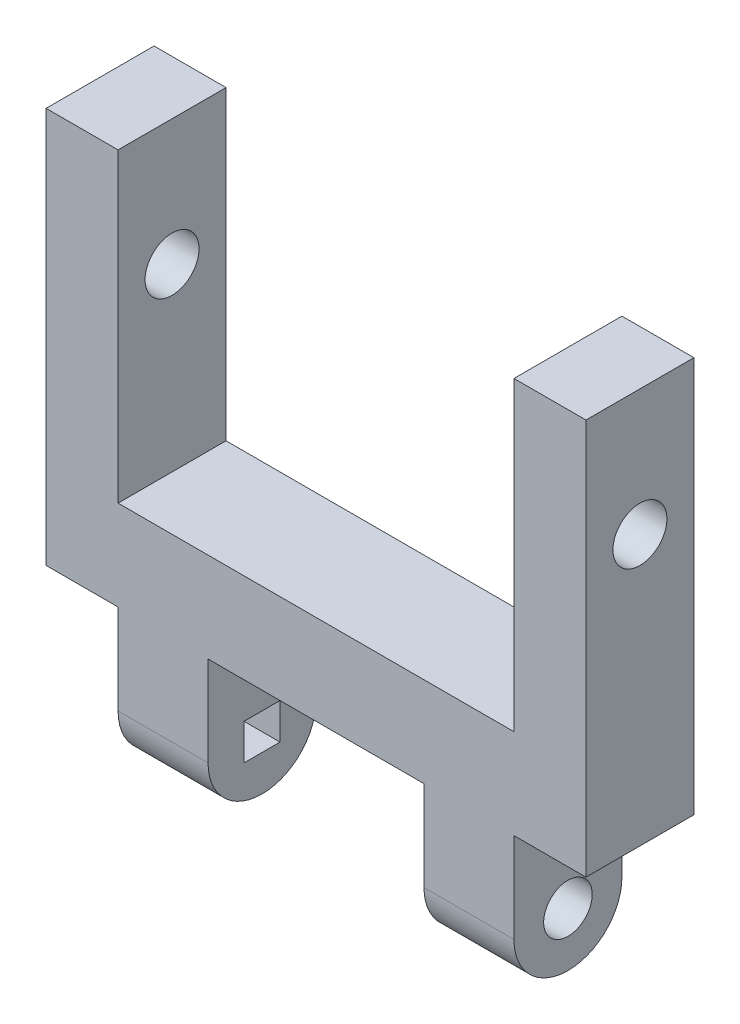
from build123d import *

# Parameters (mm, degrees)
SKETCH3_W           = 30
SKETCH3_H           = 6
BOSS_EXTRUDE2_DEPTH = 5
SKETCH4_W           = 4
SKETCH4_H           = 6
BOSS_EXTRUDE3_DEPTH = 17
SKETCH7_R           = 1.5
CUT_EXTRUDE2_DEPTH  = 50
SKETCH9_W           = 5
SKETCH9_H           = 6
BOSS_EXTRUDE5_DEPTH = 8
SKETCH10_R          = 1.35
CUT_EXTRUDE3_DEPTH  = 8
SKETCH11_W          = 2
SKETCH11_H          = 2
CUT_EXTRUDE4_DEPTH  = 8
FILLET2_R           = 3


with BuildPart() as part:
    # Sketch3 → Boss-Extrude2 (new body)
    with BuildSketch(Plane(origin=(0, 0, 0), x_dir=(1, 0, 0), z_dir=(0, 1, 0))):
        Rectangle(SKETCH3_W, SKETCH3_H)
    extrude(amount=BOSS_EXTRUDE2_DEPTH)

    # Sketch4 → Boss-Extrude3 (add)
    with BuildSketch(Plane(origin=(0, 5, 0), x_dir=(1, 0, 0), z_dir=(0, 1, 0))):
        with Locations((-13, 0)):
            Rectangle(SKETCH4_W, SKETCH4_H)
        with Locations((13, 0)):
            Rectangle(SKETCH4_W, SKETCH4_H)
    extrude(amount=BOSS_EXTRUDE3_DEPTH)

    # Sketch7 → Cut-Extrude2 (cut, symmetric)
    with BuildSketch(Plane.ZY.offset(-11)):
        with Locations((0, 15)):
            Circle(SKETCH7_R)
    extrude(amount=CUT_EXTRUDE2_DEPTH, both=True, mode=Mode.SUBTRACT)

    # Sketch9 → Boss-Extrude5 (add)
    with BuildSketch(Plane.XZ):
        with Locations((-8.5, 0)):
            Rectangle(SKETCH9_W, SKETCH9_H)
        with Locations((8.5, 0)):
            Rectangle(SKETCH9_W, SKETCH9_H)
    extrude(amount=BOSS_EXTRUDE5_DEPTH)

    # Sketch10 → Cut-Extrude3 (cut)
    with BuildSketch(Plane(origin=(11, 0, 0), x_dir=(0, 0, -1), z_dir=(1, 0, 0))):
        with Locations((0, -5)):
            Circle(SKETCH10_R)
    extrude(amount=-CUT_EXTRUDE3_DEPTH, mode=Mode.SUBTRACT)

    # Sketch11 → Cut-Extrude4 (cut)
    with BuildSketch(Plane.ZY.offset(11)):
        with Locations((0, -5)):
            Rectangle(SKETCH11_W, SKETCH11_H)
    extrude(amount=-CUT_EXTRUDE4_DEPTH, mode=Mode.SUBTRACT)

    # Fillet2
    fillet2_edges = [part.edges().sort_by_distance(p)[0] for p in [
        (-8.5, -8, -3),
        (8.5, -8, -3),
        (8.5, -8, 3),
        (-8.5, -8, 3),
    ]]
    fillet(fillet2_edges, radius=FILLET2_R - 0.0001)  # a hair under: the kernel refuses the full size


solid = part.part
